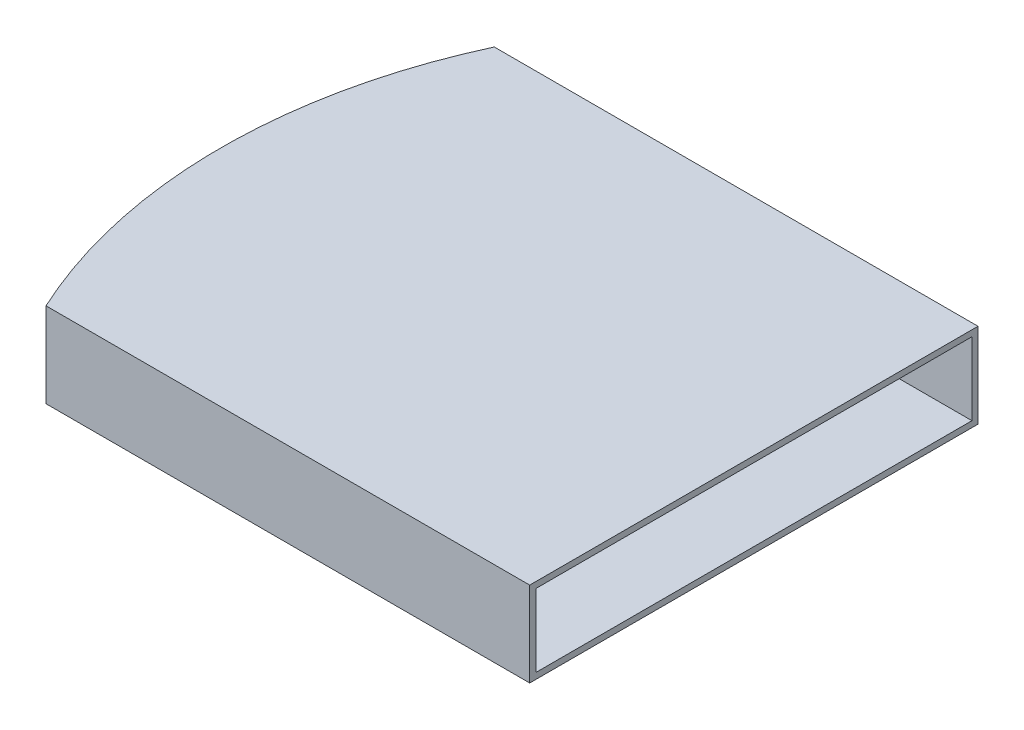
from build123d import *

# Parameters (mm, degrees)
BOSS_EXTRUDE1_DEPTH = 44.45
CUT_EXTRUDE2_DEPTH  = 228.6


with BuildPart() as part:
    # Sketch1 → Boss-Extrude1 (new body)
    with BuildSketch(Plane(origin=(0, 0, 0), x_dir=(1, 0, 0), z_dir=(0, 1, 0))):
        with BuildLine():
            Line((-253.503420835, 234.95), (0, 234.95))
            Line((0, 234.95), (0, 0))
            Line((0, 0), (-253.503420835, 0))
            ThreePointArc((-253.503420835, 0), (-279.4, 117.475), (-253.503420835, 234.95))
        make_face()
    extrude(amount=BOSS_EXTRUDE1_DEPTH)

    # Sketch2 → Cut-Extrude2 (cut)
    with BuildSketch(Plane.XY.offset(-3.175)):
        Polygon((-247.153420835, 41.275), (-215.183724887, 3.175), (32.837570188, 3.175), (32.837570188, 41.275), align=None)
    extrude(amount=-CUT_EXTRUDE2_DEPTH, mode=Mode.SUBTRACT)


solid = part.part
